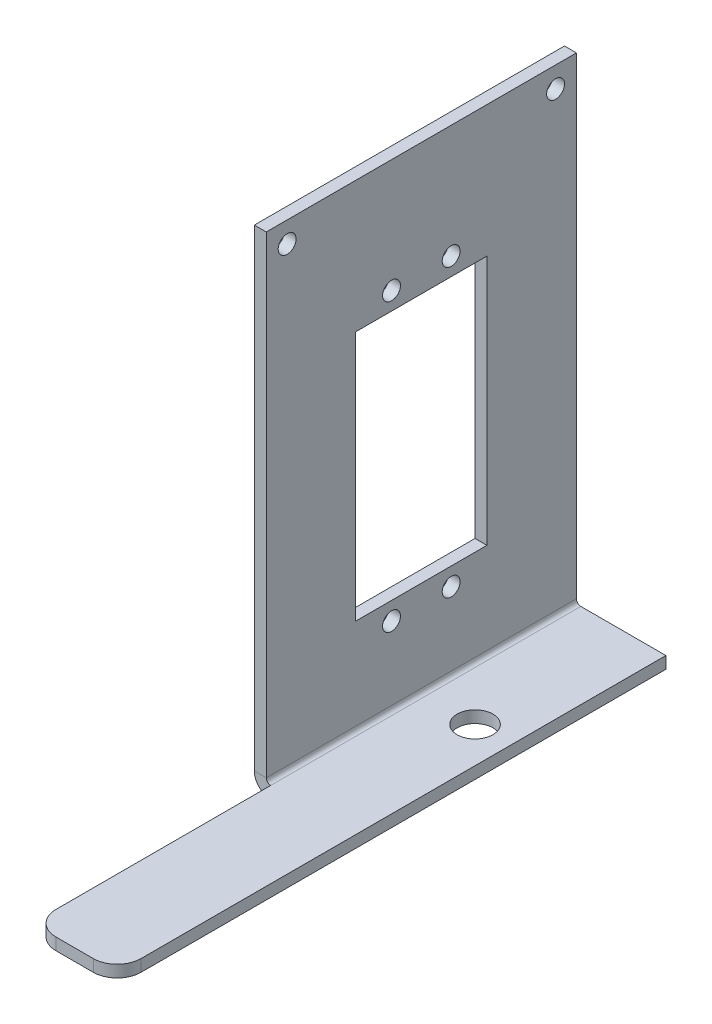
from build123d import *

# Parameters (mm, degrees)
SM_BASE_FLANGE_1_DEPTH       = 52
CUT_EXTRUDE_1_REACH          = 100.25
SKETCH_6_R                   = 3
HOLE_WIZARD_M3_2_D           = 2.5
HOLE_WIZARD_M3_2_DEPTH       = 7.5
HOLE_WIZARD_M3_2_CBORE_D     = 3
HOLE_WIZARD_M3_2_CBORE_DEPTH = 6
HOLE_WIZARD_M3_2_TIP         = 0.751075774
SKETCH_9_W                   = 22
SKETCH_9_H                   = 42
CUT_EXTRUDE_2_DEPTH          = 10
SKETCH_10_W                  = 40
SKETCH_10_H                  = 14.2634
EXTRUDE_4_DEPTH              = 2
FILLET_1_R                   = 4


# Sheet-metal steps are written as plain solids
with BuildPart() as part:
    # Sketch 1 → 基材-凸緣1 (new body)
    with BuildSketch(Plane.XY):
        with BuildLine():
            Line((0, 80), (0, 0.7366))
            ThreePointArc((0, 0.7366), (0.215745145, 0.215745145), (0.7366, 0))
            Line((0.7366, 0), (15, 0))
            Line((15, 0), (15, -2))
            Line((15, -2), (0.7366, -2))
            ThreePointArc((0.7366, -2), (-1.198468417, -1.198468417), (-2, 0.7366))
            Line((-2, 0.7366), (-2, 80))
            Line((-2, 80), (0, 80))
        make_face()
    extrude(amount=SM_BASE_FLANGE_1_DEPTH)

    # 草圖6 → 除料-伸長1 (cut, up to next)
    with BuildSketch(Plane.XZ.offset(2), mode=Mode.PRIVATE) as cut_extrude_1_sk1:
        with Locations(Location((9, 26, 0), (0, 0, 270))):
            Circle(SKETCH_6_R)
    cut_extrude_1_tool1 = extrude(cut_extrude_1_sk1.sketch, amount=-CUT_EXTRUDE_1_REACH, mode=Mode.PRIVATE) & part.part
    add(cut_extrude_1_tool1.solids().sort_by_distance((9, -2, 26))[0], mode=Mode.SUBTRACT)

    # M3 螺紋孔2
    with Locations(Plane.ZY.offset(2)):
        with Locations((21, 61), (21, 13), (31, 13), (31, 61), (3.5, 76.5), (48.5, 76.5)):
            CounterBoreHole(HOLE_WIZARD_M3_2_D / 2, HOLE_WIZARD_M3_2_CBORE_D / 2, HOLE_WIZARD_M3_2_CBORE_DEPTH, depth=HOLE_WIZARD_M3_2_DEPTH)
            with Locations((0, 0, -(HOLE_WIZARD_M3_2_DEPTH + HOLE_WIZARD_M3_2_TIP / 2))):  # 118° drill point
                Cone(0, HOLE_WIZARD_M3_2_D / 2, HOLE_WIZARD_M3_2_TIP, mode=Mode.SUBTRACT)

    # 草圖9 → 除料-伸長2 (cut)
    with BuildSketch(Plane(origin=(0, 0, 0), x_dir=(0, 0, -1), z_dir=(1, 0, 0))):
        with Locations((-26, 37)):
            Rectangle(SKETCH_9_W, SKETCH_9_H)
    extrude(amount=-CUT_EXTRUDE_2_DEPTH, mode=Mode.SUBTRACT)

    # 草圖10 → 填料-伸長4 (add)
    with BuildSketch(Plane.ZX.offset(-2)):
        with Locations((72, 7.8683)):
            Rectangle(SKETCH_10_W, SKETCH_10_H)
    extrude(amount=EXTRUDE_4_DEPTH)

    # 圓角1
    fillet_1_edges = [part.edges().sort_by_distance(p)[0] for p in [
        (0.7366, -1, 92),
        (15, -1, 92),
    ]]
    fillet(fillet_1_edges, radius=FILLET_1_R)


solid = part.part
